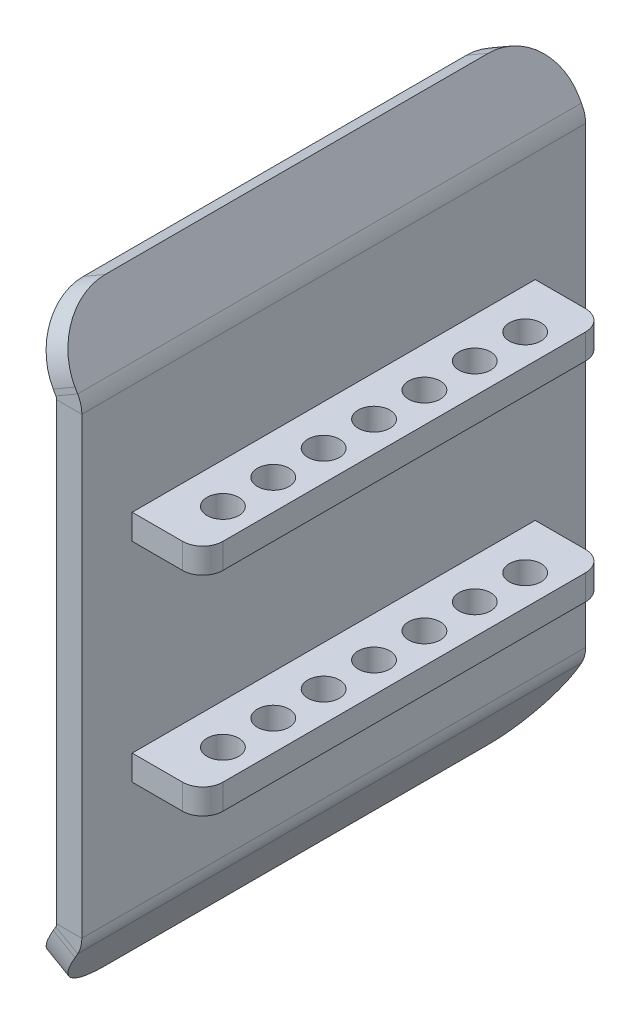
from build123d import *

# Parameters (mm, degrees)
BASE_FLANGE1_DEPTH     = 3.175
SKETCHED_START         = -31.75
SKETCHED_BEND3_DEPTH   = 63.5
SKETCHED_BEND3_2_DEPTH = 63.5
SKETCHED_START_2       = -18.235018827
SKETCHED_BEND3_3_DEPTH = 33.059849879
SKETCHED_BEND3_4_DEPTH = 33.059849879
SKETCH11_W             = 50.8
SKETCH11_H             = 3.175
BOSS_EXTRUDE4_DEPTH    = 8.89
BOSS_EXTRUDE4_2_DEPTH  = 8.89
CUT_EXTRUDE1_START     = -29.464
SKETCH14_R             = 2
CUT_EXTRUDE1_DEPTH     = 29.464
FILLET1_R              = 2.54
FILLET2_R              = 2.54


with BuildPart() as part:
    # Base-Flange1: sheet metal written as solids
    # Sketch1 → Base-Flange1 (new body)
    with BuildSketch(Plane(origin=(0, 0, 0), x_dir=(0, 0, -1), z_dir=(1, 0, 0))):
        with BuildLine():
            Line((24.135978559, -38.1), (-24.135978559, -38.1))
            ThreePointArc((-24.135978559, -38.1), (-29.519904752, -35.869904752), (-31.75, -30.485978559))
            Line((-31.75, -30.485978559), (-31.75, 30.485978559))
            ThreePointArc((-31.75, 30.485978559), (-29.519904752, 35.869904752), (-24.135978559, 38.1))
            Line((-24.135978559, 38.1), (24.135978559, 38.1))
            ThreePointArc((24.135978559, 38.1), (29.519904752, 35.869904752), (31.75, 30.485978559))
            Line((31.75, 30.485978559), (31.75, -30.485978559))
            ThreePointArc((31.75, -30.485978559), (29.519904752, -35.869904752), (24.135978559, -38.1))
        make_face()
    extrude(amount=-BASE_FLANGE1_DEPTH)

    # Sketched Bend3: read off the stored shape, not the designer's step
    # Sketched Bend3 outline → Sketched Bend3 (cut)
    with BuildSketch(Plane.XY.offset(SKETCHED_START)):
        with BuildLine():
            Line((-0.524055031, -30.557352043), (-3.175, -35.148923418))
            Line((-3.175, -35.148923418), (-3.175, -38.1))
            Line((-3.175, -38.1), (0, -38.1))
            Line((0, -38.1), (0, -28.601552043))
            ThreePointArc((0, -28.601552043), (-0.133284538, -29.61394862), (-0.524055031, -30.557352043))
        make_face()
        with BuildLine():
            Line((-3.175, 38.1), (-3.175, 35.148923418))
            Line((-3.175, 35.148923418), (-0.524055031, 30.557352043))
            ThreePointArc((-0.524055031, 30.557352043), (-0.133284538, 29.61394862), (0, 28.601552043))
            Line((0, 28.601552043), (0, 38.1))
            Line((0, 38.1), (-3.175, 38.1))
        make_face()
    extrude(amount=SKETCHED_BEND3_DEPTH, mode=Mode.SUBTRACT)

    # Sketched Bend3 2 outline → Sketched Bend3 2 (add)
    with BuildSketch(Plane.XY.offset(SKETCHED_START)):
        with BuildLine():
            ThreePointArc((-3.175, -28.601552043), (-3.200099036, -28.792198152), (-3.273685688, -28.969852043))
            Line((-3.273685688, -28.969852043), (-7.414461709, -36.141886495))
            Line((-7.414461709, -36.141886495), (-4.664831052, -37.729386495))
            Line((-4.664831052, -37.729386495), (-0.524055031, -30.557352043))
            ThreePointArc((-0.524055031, -30.557352043), (-0.133284538, -29.61394862), (0, -28.601552043))
            Line((0, -28.601552043), (0, 28.601552043))
            ThreePointArc((0, 28.601552043), (-0.133284538, 29.61394862), (-0.524055031, 30.557352043))
            Line((-0.524055031, 30.557352043), (-4.664831052, 37.729386495))
            Line((-4.664831052, 37.729386495), (-7.414461709, 36.141886495))
            Line((-7.414461709, 36.141886495), (-3.273685688, 28.969852043))
            ThreePointArc((-3.273685688, 28.969852043), (-3.200099036, 28.792198152), (-3.175, 28.601552043))
            Line((-3.175, 28.601552043), (-3.175, -28.601552043))
        make_face()
    extrude(amount=SKETCHED_BEND3_2_DEPTH)

    # Sketched Bend3 3 outline → Sketched Bend3 3 (cut)
    with BuildSketch(Plane(origin=(0, 0, 0), x_dir=(0.500000000000001, 0.866025403784438, 0), z_dir=(0.866025403784438, -0.500000000000001, 0)).offset(SKETCHED_START_2)):
        with BuildLine():
            ThreePointArc((-27.393001259, -31.75), (-32.776927452, -29.519904752), (-35.0070227, -24.135978559))
            Line((-35.0070227, -24.135978559), (-35.0070227, -31.75))
            Line((-35.0070227, -31.75), (-27.393001259, -31.75))
        make_face()
        with BuildLine():
            ThreePointArc((-35.0070227, 24.135978559), (-32.776927452, 29.519904752), (-27.393001259, 31.75))
            Line((-27.393001259, 31.75), (-35.0070227, 31.75))
            Line((-35.0070227, 31.75), (-35.0070227, 24.135978559))
        make_face()
    extrude(amount=SKETCHED_BEND3_3_DEPTH, mode=Mode.SUBTRACT)

    # Sketched Bend3 4 outline → Sketched Bend3 4 (cut)
    with BuildSketch(Plane(origin=(0, 0, 0), x_dir=(0.500000000000001, -0.866025403784438, 0), z_dir=(0.866025403784438, 0.500000000000001, 0)).offset(SKETCHED_START_2)):
        with BuildLine():
            ThreePointArc((-27.393001259, -31.75), (-32.776927452, -29.519904752), (-35.0070227, -24.135978559))
            Line((-35.0070227, -24.135978559), (-35.0070227, -31.75))
            Line((-35.0070227, -31.75), (-27.393001259, -31.75))
        make_face()
        with BuildLine():
            ThreePointArc((-35.0070227, 24.135978559), (-32.776927452, 29.519904752), (-27.393001259, 31.75))
            Line((-27.393001259, 31.75), (-35.0070227, 31.75))
            Line((-35.0070227, 31.75), (-35.0070227, 24.135978559))
        make_face()
    extrude(amount=SKETCHED_BEND3_4_DEPTH, mode=Mode.SUBTRACT)


with BuildPart() as body_2:
    # Sketch11 → Boss-Extrude4 (new body)
    with BuildSketch(Plane(origin=(0, 0, 0), x_dir=(0, 0, -1), z_dir=(1, 0, 0))):
        with Locations((0, -13.1445)):
            Rectangle(SKETCH11_W, SKETCH11_H)
    extrude(amount=BOSS_EXTRUDE4_DEPTH)


with BuildPart() as body_3:
    # Sketch11 → Boss-Extrude4 2 (new body)
    with BuildSketch(Plane(origin=(0, 0, 0), x_dir=(0, 0, -1), z_dir=(1, 0, 0))):
        with Locations((0, 13.1445)):
            Rectangle(SKETCH11_W, SKETCH11_H)
    extrude(amount=BOSS_EXTRUDE4_2_DEPTH)


with BuildPart() as cut_extrude1_tool:
    # Sketch14 → Cut-Extrude1 (new body)
    with BuildSketch(Plane(origin=(0, 14.732, 0), x_dir=(1, 0, 0), z_dir=(0, 1, 0)).offset(CUT_EXTRUDE1_START)):
        with Locations(Location((5.08, -12.7, 0), (0, 0, 270))):
            Circle(SKETCH14_R)
        with Locations(Location((5.08, -6.35, 0), (0, 0, 270))):
            Circle(SKETCH14_R)
        with Locations(Location((5.08, 0, 0), (0, 0, 270))):
            Circle(SKETCH14_R)
        with Locations(Location((5.08, 6.35, 0), (0, 0, 270))):
            Circle(SKETCH14_R)
        with Locations(Location((5.08, 12.7, 0), (0, 0, 270))):
            Circle(SKETCH14_R)
        with Locations(Location((5.08, -19.05, 0), (0, 0, 270))):
            Circle(SKETCH14_R)
        with Locations(Location((5.08, 19.05, 0), (0, 0, 270))):
            Circle(SKETCH14_R)
    extrude(amount=CUT_EXTRUDE1_DEPTH)


with BuildPart() as body_2_1:
    add(body_2.part)

    # Cut-Extrude1: cut by cut_extrude1_tool
    add(cut_extrude1_tool.part, mode=Mode.SUBTRACT)

    # Fillet1
    fillet1_edges = [body_2_1.edges().sort_by_distance(p)[0] for p in [
        (8.89, -13.1445, -25.4),
        (8.89, -13.1445, 25.4),
    ]]
    fillet(fillet1_edges, radius=FILLET1_R)


with BuildPart() as body_3_1:
    add(body_3.part)

    # Cut-Extrude1: cut by cut_extrude1_tool
    add(cut_extrude1_tool.part, mode=Mode.SUBTRACT)

    # Fillet2
    fillet2_edges = [body_3_1.edges().sort_by_distance(p)[0] for p in [
        (8.89, 13.1445, -25.4),
        (8.89, 13.1445, 25.4),
    ]]
    fillet(fillet2_edges, radius=FILLET2_R)


solid = Compound([part.part, body_2_1.part, body_3_1.part])
